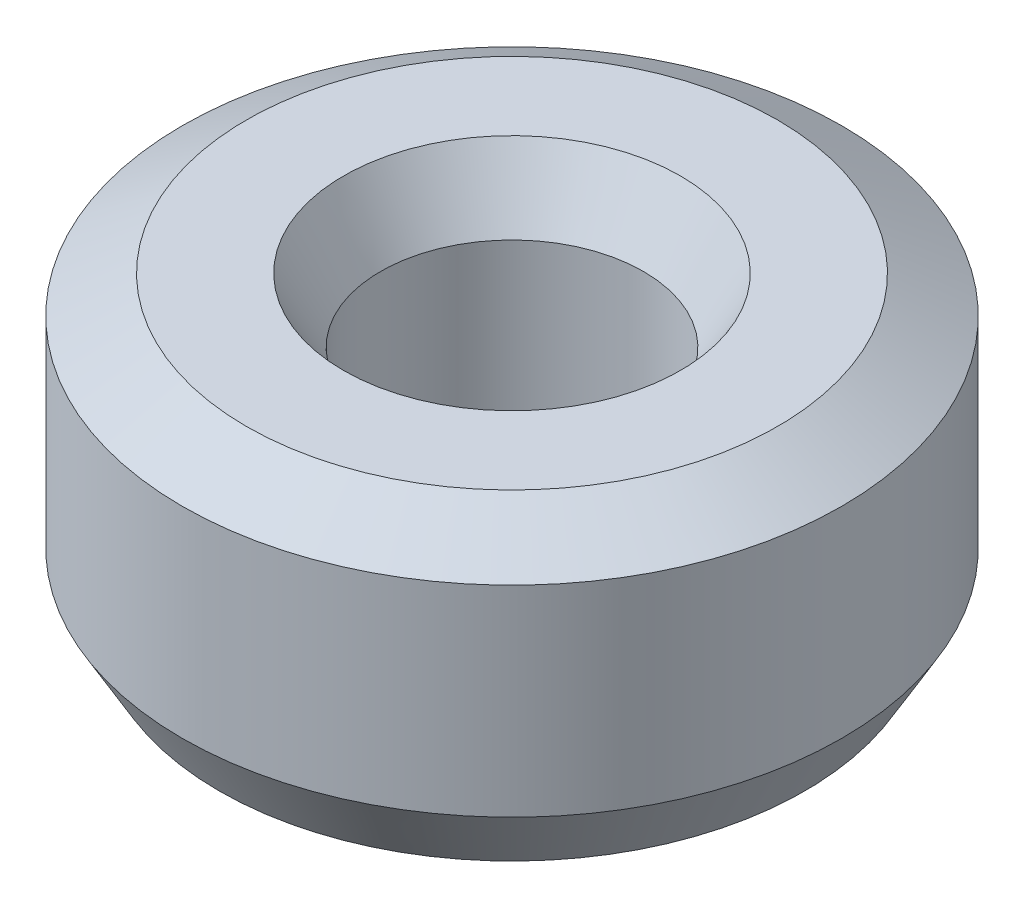
from build123d import *
from OCP.BRepFilletAPI import BRepFilletAPI_MakeChamfer

# Parameters (mm, degrees)
SKETCH1_R           = 35
BOSS_EXTRUDE1_DEPTH = 32.079970965
SKETCH2_R           = 13.954865539
CUT_EXTRUDE1_DEPTH  = 59.984104105
CHAMFER1_SIZE       = 3.932913404
CHAMFER1_SIZE2      = 6.812005837


with BuildPart() as part:
    # Sketch1 → Boss-Extrude1 (new body)
    with BuildSketch(Plane(origin=(0, 0, 0), x_dir=(1, 0, 0), z_dir=(0, 1, 0))):
        Circle(SKETCH1_R)
    extrude(amount=BOSS_EXTRUDE1_DEPTH)

    # Sketch2 → Cut-Extrude1 (cut, through all)
    with BuildSketch(Plane(origin=(0, 0, 0), x_dir=(1, 0, 0), z_dir=(0, 1, 0))):
        Circle(SKETCH2_R)
    extrude(amount=CUT_EXTRUDE1_DEPTH, mode=Mode.SUBTRACT)

    # Chamfer1: one chamfer whose edges measure the first distance from different faces: ONE call of the kernel's chamfer builder (chamfer() names one face for all edges)
    chamfer1_edges_1 = [part.edges().sort_by_distance(p)[0] for p in [
        (-13.954865539, 32.079970965, 0),
    ]]
    chamfer1_side_1 = [part.faces().sort_by_distance(p)[0] for p in [
        (-34.010050506, 32.079970965, 0),
    ]]
    chamfer1_edges_2 = [part.edges().sort_by_distance(p)[0] for p in [
        (-13.954865539, 0, 0),
    ]]
    chamfer1_side_2 = [part.faces().sort_by_distance(p)[0] for p in [
        (-13.954865539, 16.039985483, 0),
    ]]
    chamfer1_edges_3 = [part.edges().sort_by_distance(p)[0] for p in [
        (-35, 0, 0),
    ]]
    chamfer1_side_3 = [part.faces().sort_by_distance(p)[0] for p in [
        (-34.010050506, 0, 0),
    ]]
    chamfer1_edges_4 = [part.edges().sort_by_distance(p)[0] for p in [
        (-35, 32.079970965, 0),
    ]]
    chamfer1_side_4 = [part.faces().sort_by_distance(p)[0] for p in [
        (-35, 16.039985483, 0),
    ]]
    chamfer1 = BRepFilletAPI_MakeChamfer(part.part.solid().wrapped)
    for e in chamfer1_edges_1:
        chamfer1.Add(CHAMFER1_SIZE, CHAMFER1_SIZE2, e.wrapped, chamfer1_side_1[0].wrapped)  # the first distance lies on this face
    for e in chamfer1_edges_2:
        chamfer1.Add(CHAMFER1_SIZE, CHAMFER1_SIZE2, e.wrapped, chamfer1_side_2[0].wrapped)  # the first distance lies on this face
    for e in chamfer1_edges_3:
        chamfer1.Add(CHAMFER1_SIZE, CHAMFER1_SIZE2, e.wrapped, chamfer1_side_3[0].wrapped)  # the first distance lies on this face
    for e in chamfer1_edges_4:
        chamfer1.Add(CHAMFER1_SIZE, CHAMFER1_SIZE2, e.wrapped, chamfer1_side_4[0].wrapped)  # the first distance lies on this face
    add(Compound.cast(chamfer1.Shape()), mode=Mode.REPLACE)


solid = part.part
